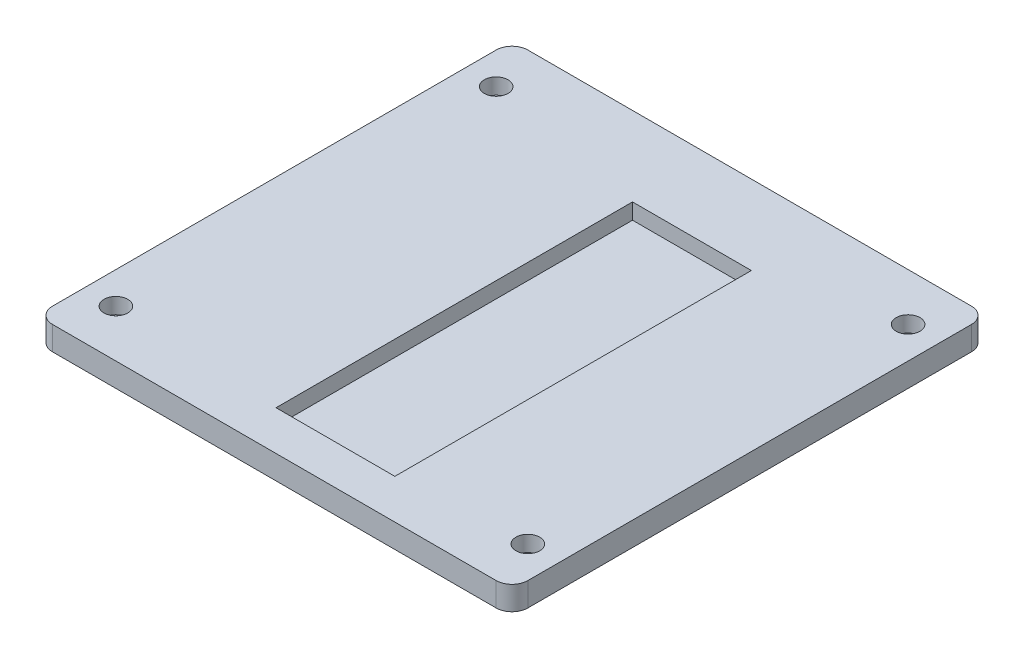
from build123d import *
from build123d.topology import SkipClean

# Parameters (mm, degrees)
CORTAR_EXTRUIR7_REACH      = 34.904
CORTAR_EXTRUIR7_END_RADIUS = 4.5
CROQUIS17_R                = 1.5
CORTAR_EXTRUIR10_START     = -3
CORTAR_EXTRUIR10_DEPTH     = 6
CROQUIS21_W                = 3.1
CROQUIS21_H                = 3.480038904
CHAFL_N2_SIZE              = 0.5
CROQUIS22_W                = 60
CROQUIS22_H                = 60
SALIENTE_EXTRUIR1_DEPTH    = 3
REDONDEO1_R                = 2
CROQUIS23_R                = 1.5
CROQUIS23_W                = 15
CROQUIS23_H                = 45
CORTAR_EXTRUIR11_DEPTH     = 2


with BuildPart() as part:
    # Croquis9 → Revolución3 (revolve)
    with BuildSketch(Plane.XY, mode=Mode.PRIVATE) as revoluci_n3_sk:
        Polygon((0, 10.708007251), (-22, 10.708007251), (-22, 7.708007251), (-13.488403702, 7.708007251), (-4.5, 6.708007251), (-4.5, -1.291992749), (0, -1.291992749), align=None)
    revolve(revoluci_n3_sk.sketch.rotate(Axis((0, 17.712309747, 0), (0, -1, 0)), 270), axis=Axis((0, 17.712309747, 0), (0, -1, 0)))

    # Cortar-Extruir7: up to this cylinder (the profile starts inside it)
    cortar_extruir7_end = Plane(origin=(0, 4.708007, 0), z_dir=(0, 1, 0)) * Cylinder(CORTAR_EXTRUIR7_END_RADIUS, 79.808, mode=Mode.PRIVATE)
    # Croquis17 → Cortar-Extruir7 (cut, up to the surface)
    with BuildSketch(Plane(origin=(0, 0, 0), x_dir=(0, 0, -1), z_dir=(1, 0, 0)), mode=Mode.PRIVATE) as cortar_extruir7_sk1:
        with Locations(Location((0, 4.708007251, 0), (0, 0, 180))):
            Circle(CROQUIS17_R)
    cortar_extruir7_tool1 = extrude(cortar_extruir7_sk1.sketch, amount=CORTAR_EXTRUIR7_REACH, mode=Mode.PRIVATE) & cortar_extruir7_end
    add(cortar_extruir7_tool1.solids().sort_by_distance((0, 4.708007, 0))[0], mode=Mode.SUBTRACT)

    # Croquis18 → Cortar-Extruir10 (cut)
    with BuildSketch(Plane(origin=(0, 10.708007251, 0), x_dir=(1, 0, 0), z_dir=(0, 1, 0)).offset(CORTAR_EXTRUIR10_START)):
        with BuildLine():
            Line((1, 2.93428015), (1, -2.93428015))
            ThreePointArc((1, -2.93428015), (-3.1, 0), (1, 2.93428015))
        make_face()
    extrude(amount=-CORTAR_EXTRUIR10_DEPTH, mode=Mode.SUBTRACT)

    # Croquis21 → Cortar-Revolución1 (revolve, cut)
    with SkipClean():  # the faces are left unmerged after this step: merging them gives an invalid solid
        with BuildSketch(Plane.XY, mode=Mode.PRIVATE) as cortar_revoluci_n1_sk:
            with Locations((-1.55, 0.068456853)):
                Rectangle(CROQUIS21_W, CROQUIS21_H)
        revolve(cortar_revoluci_n1_sk.sketch.rotate(Axis((0, 3.581140077, 0), (0, -1, 0)), 251.180936631), axis=Axis((0, 3.581140077, 0), (0, -1, 0)), mode=Mode.SUBTRACT)

    # Chaflán2
    # the kernel refuses this chamfer: 0.5 mm, written as the material it takes off along each edge
    with BuildSketch(Plane(origin=(1, 1.808476305, 4.220121644), x_dir=(-0.02749587661058627, 0.9996219169112968, 0), z_dir=(0, 0, -1))) as chafl_n2_piece_1_section:
        Polygon((CHAFL_N2_SIZE * 0.999621916911, CHAFL_N2_SIZE * 0.0274958766106), (-CHAFL_N2_SIZE * 0.0274958766106, CHAFL_N2_SIZE * 0.999621916911), (0, 0), align=None)
    chafl_n2_piece_1 = extrude(amount=8.440243288, mode=Mode.PRIVATE)
    chafl_n2_piece_1 = chafl_n2_piece_1 & Plane(origin=(0, 1.974615601, 0), x_dir=(0.32258064516148965, 0, 0.946541983943236), z_dir=(0, -1, 0)) * Cylinder(3.1, 19, mode=Mode.PRIVATE)
    add(chafl_n2_piece_1, mode=Mode.SUBTRACT)

    # Croquis22 → Saliente-Extruir1 (add)
    with BuildSketch(Plane(origin=(0, 10.708007251, 0), x_dir=(1, 0, 0), z_dir=(0, 1, 0))):
        Rectangle(CROQUIS22_W, CROQUIS22_H)
    extrude(amount=-SALIENTE_EXTRUIR1_DEPTH)

    # Redondeo1
    redondeo1_edges = [part.edges().sort_by_distance(p)[0] for p in [
        (-30, 9.208007251, -30),
        (-30, 9.208007251, 30),
        (30, 9.208007251, 30),
        (30, 9.208007251, -30),
    ]]
    fillet(redondeo1_edges, radius=REDONDEO1_R)

    # Croquis23 → Cortar-Extruir11 (cut)
    with BuildSketch(Plane(origin=(0, 10.708007251, 0), x_dir=(1, 0, 0), z_dir=(0, 1, 0))):
        with Locations(Location((-26, 24, 0), (0, 0, 270))):
            Circle(CROQUIS23_R)
        with Locations(Location((-26, -24, 0), (0, 0, 270))):
            Circle(CROQUIS23_R)
        with Locations(Location((26, -24, 0), (0, 0, 270))):
            Circle(CROQUIS23_R)
        with Locations(Location((26, 24, 0), (0, 0, 270))):
            Circle(CROQUIS23_R)
        with Locations((2.713645645, -2.5)):
            Rectangle(CROQUIS23_W, CROQUIS23_H)
    extrude(amount=-CORTAR_EXTRUIR11_DEPTH, mode=Mode.SUBTRACT)


solid = part.part
